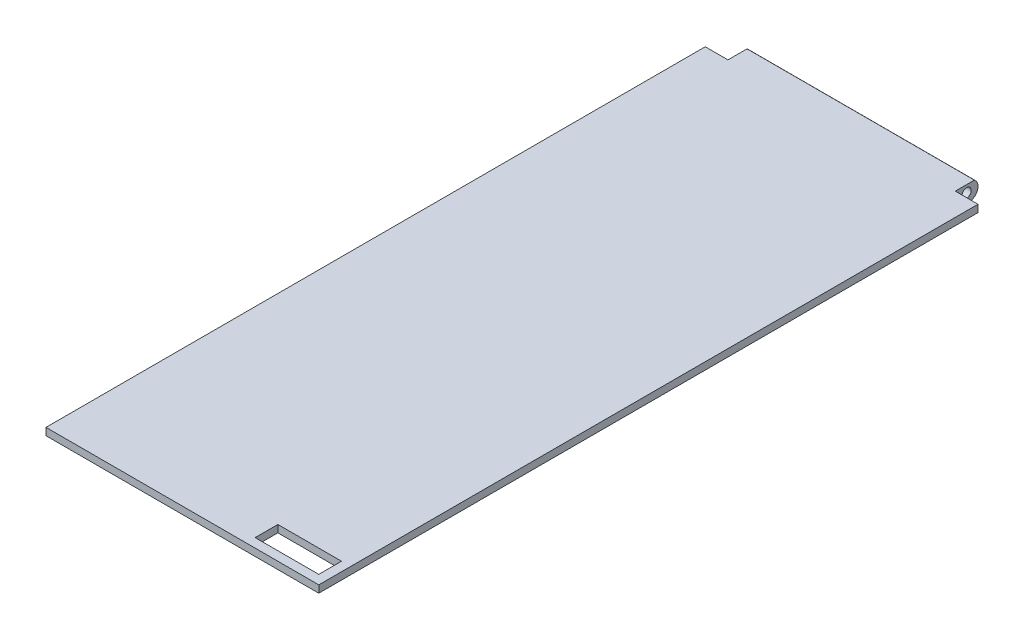
from build123d import *

# Parameters (mm, degrees)
SKETCH1_W           = 30
SKETCH1_H           = 70
BOSS_EXTRUDE1_DEPTH = 1
SKETCH5_W           = 30
SKETCH5_H           = 1
BOSS_EXTRUDE3_DEPTH = 5
SKETCH6_W           = 7
SKETCH6_H           = 2.5
CUT_EXTRUDE3_DEPTH  = 1
SKETCH2_W           = 30
SKETCH2_H           = 2.5
BOSS_EXTRUDE4_DEPTH = 1
CUT_EXTRUDE4_START  = -30
SKETCH7_R           = 0.5
CUT_EXTRUDE4_DEPTH  = 30
FILLET1_R           = 1
SKETCH9_W           = 3
SKETCH9_H           = 2
CUT_EXTRUDE5_DEPTH  = 2.5
SKETCH10_W          = 3
SKETCH10_H          = 2
CUT_EXTRUDE6_DEPTH  = 2.5
SKETCH11_W          = 33.967551934
SKETCH11_H          = 76.426629991
CUT_EXTRUDE7_DEPTH  = 0.2


with BuildPart() as part:
    # Sketch1 → Boss-Extrude1 (new body)
    with BuildSketch(Plane(origin=(0, 0, 0), x_dir=(1, 0, 0), z_dir=(0, 1, 0))):
        Rectangle(SKETCH1_W, SKETCH1_H)
    extrude(amount=BOSS_EXTRUDE1_DEPTH)

    # Sketch5 → Boss-Extrude3 (add)
    with BuildSketch(Plane.XY.offset(35)):
        with Locations((0, 0.5)):
            Rectangle(SKETCH5_W, SKETCH5_H)
    extrude(amount=BOSS_EXTRUDE3_DEPTH)

    # Sketch6 → Cut-Extrude3 (cut)
    with BuildSketch(Plane(origin=(0, 1, 0), x_dir=(1, 0, 0), z_dir=(0, 1, 0))):
        with Locations((10.5, -37.75)):
            Rectangle(SKETCH6_W, SKETCH6_H)
    extrude(amount=-CUT_EXTRUDE3_DEPTH, mode=Mode.SUBTRACT)

    # Sketch2 → Boss-Extrude4 (add)
    with BuildSketch(Plane(origin=(0, 0, 0), x_dir=(1, 0, 0), z_dir=(0, 1, 0))):
        with Locations((0, 33.75)):
            Rectangle(SKETCH2_W, SKETCH2_H)
    extrude(amount=-BOSS_EXTRUDE4_DEPTH)

    # Sketch7 → Cut-Extrude4 (cut)
    with BuildSketch(Plane.ZY.offset(15).offset(CUT_EXTRUDE4_START)):
        with Locations((-33.75, 0)):
            Circle(SKETCH7_R)
    extrude(amount=CUT_EXTRUDE4_DEPTH, mode=Mode.SUBTRACT)

    # Fillet1
    fillet1_edges = [part.edges().sort_by_distance(p)[0] for p in [
        (0, -1, -35),
        (0, 1, -35),
    ]]
    fillet(fillet1_edges, radius=FILLET1_R - 0.0001)  # a hair under: the kernel refuses the full size

    # Sketch9 → Cut-Extrude5 (cut)
    with BuildSketch(Plane.ZY.offset(15)):
        with Locations((-34, 0)):
            Rectangle(SKETCH9_W, SKETCH9_H)
    extrude(amount=-CUT_EXTRUDE5_DEPTH, mode=Mode.SUBTRACT)

    # Sketch10 → Cut-Extrude6 (cut)
    with BuildSketch(Plane(origin=(15, 0, 0), x_dir=(0, 0, -1), z_dir=(1, 0, 0))):
        with Locations((34, 0)):
            Rectangle(SKETCH10_W, SKETCH10_H)
    extrude(amount=-CUT_EXTRUDE6_DEPTH, mode=Mode.SUBTRACT)

    # Sketch11 → Cut-Extrude7 (cut)
    with BuildSketch(Plane(origin=(0, 1, 0), x_dir=(1, 0, 0), z_dir=(0, 1, 0))):
        with Locations((-1.983775967, -1.786685004)):
            Rectangle(SKETCH11_W, SKETCH11_H)
    extrude(amount=-CUT_EXTRUDE7_DEPTH, mode=Mode.SUBTRACT)


solid = part.part
